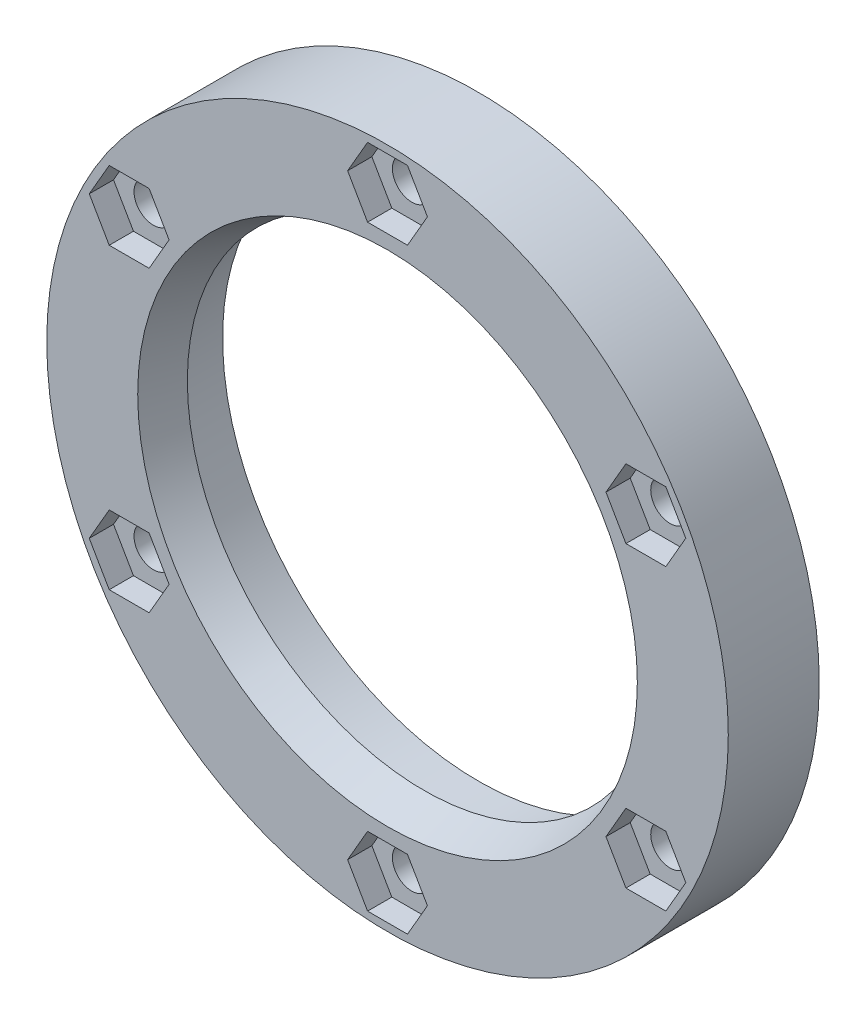
from build123d import *

# Parameters (mm, degrees)
SKETCH1_R            = 28.1
SKETCH1_R_2          = 21.1
BOSS_EXTRUDE1_DEPTH  = 4.5
SKETCH2_R            = 28.1
SKETCH2_R_2          = 18.6
BOSS_EXTRUDE2_DEPTH  = 3
M3_CLEARANCE_HOLE1_D = 3.2
CUT_EXTRUDE1_DEPTH   = 2
CIRPATTERN1_COUNT    = 6
CHAMFER1_SIZE        = 2
CHAMFER1_SIZE_2      = 5.494954839


with BuildPart() as part:
    # Sketch1 → Boss-Extrude1 (new body)
    with BuildSketch(Plane.XY):
        Circle(SKETCH1_R)
        Circle(SKETCH1_R_2, mode=Mode.SUBTRACT)
    extrude(amount=BOSS_EXTRUDE1_DEPTH)

    # Sketch2 → Boss-Extrude2 (add)
    with BuildSketch(Plane.XY.offset(4.5)):
        Circle(SKETCH2_R)
        Circle(SKETCH2_R_2, mode=Mode.SUBTRACT)
    extrude(amount=BOSS_EXTRUDE2_DEPTH)

    # M3 Clearance Hole1 (through all)
    with Locations(Plane(origin=(0, 0, 0), x_dir=(-1, 0, 0), z_dir=(0, 0, -1))):
        with Locations((0, 24.6)):
            m3_clearance_hole1 = Hole(M3_CLEARANCE_HOLE1_D / 2)

    # Sketch5 → Cut-Extrude1 (cut)
    with BuildSketch(Plane.XY.offset(7.5)):
        Polygon((-1.645448267, 27.45), (1.645448267, 27.45), (3.290896534, 24.6), (1.645448267, 21.75), (-1.645448267, 21.75), (-3.290896534, 24.6), align=None)
    cut_extrude1 = extrude(amount=-CUT_EXTRUDE1_DEPTH, mode=Mode.SUBTRACT)

    # CirPattern1: M3 Clearance Hole1, Cut-Extrude1 ×6 about axis
    cirpattern1_axis = Axis((0, 0, 0), (0, 0, 1))
    add([m3_clearance_hole1.rotate(cirpattern1_axis, i * 360 / CIRPATTERN1_COUNT) for i in range(1, CIRPATTERN1_COUNT)], mode=Mode.SUBTRACT)
    add([cut_extrude1.rotate(cirpattern1_axis, i * 360 / CIRPATTERN1_COUNT) for i in range(1, CIRPATTERN1_COUNT)], mode=Mode.SUBTRACT)

    # Chamfer1
    # the kernel refuses this chamfer: 5.494954839, 2 mm, written as the material it takes off along each edge
    with BuildSketch(Plane(origin=(0, 0, 7.5), x_dir=(1, 0, 0), z_dir=(0, -1, 0))) as chamfer1_piece_1:
        Polygon((18.6 + CHAMFER1_SIZE, 0), (18.6, -CHAMFER1_SIZE_2), (18.6, 0), align=None)
    revolve(axis=Axis((0, 0, 7.5), (0, 0, 1)), mode=Mode.SUBTRACT)


solid = part.part
